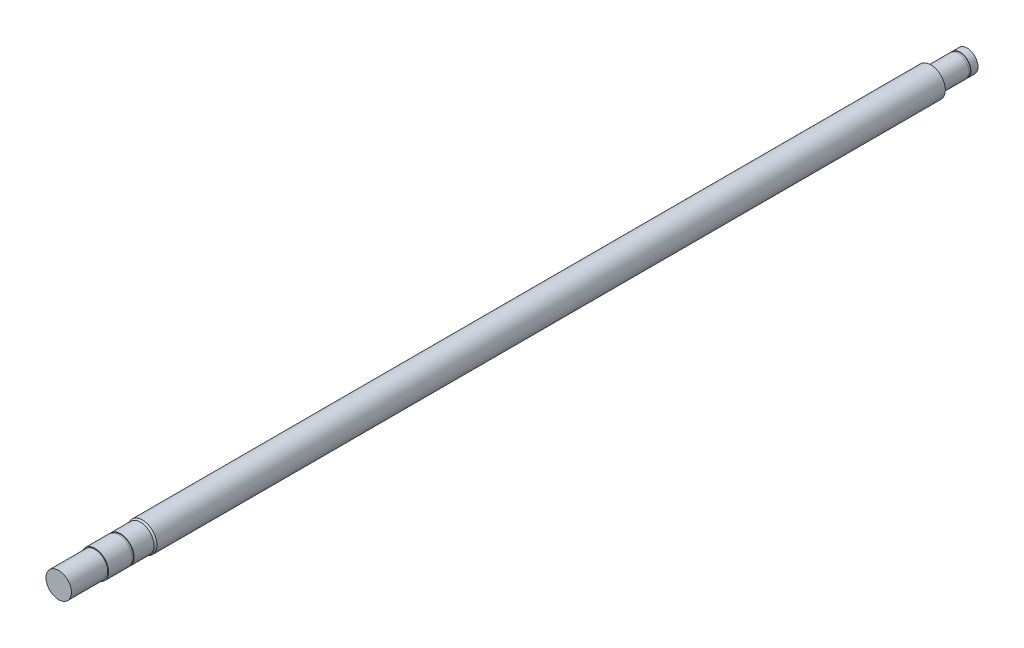
from build123d import *

# Parameters (mm, degrees)
SWEEP_1_PROFILE_R   = 8
SKETCH_11_OUTSIDE_W = 118.102
SKETCH_11_OUTSIDE_H = 118.102
SKETCH_11_OUTSIDE_R = 7
CUT_EXTRUDE_1_DEPTH = 20
SKETCH_16_OUTSIDE_W = 118.102
SKETCH_16_OUTSIDE_H = 118.102
SKETCH_16_OUTSIDE_R = 7.5
CUT_EXTRUDE_3_DEPTH = 25
SKETCH_31_W         = 1.1
SKETCH_31_H         = 0.35
SKETCH_12_OUTSIDE_W = 118.102
SKETCH_12_OUTSIDE_H = 118.102
SKETCH_12_OUTSIDE_R = 6
CUT_EXTRUDE_2_DEPTH = 20
SKETCH_3_W          = 1.1
SKETCH_3_H          = 0.25


# Read off the part's stored shape, not the designer's step: M16 机械螺纹 螺柱1
with BuildPart() as part:
    # 扫描1: sweep along a path in 草图1
    with BuildLine(Plane(origin=(0, 0, 0), x_dir=(0, 0, -1), z_dir=(1, 0, 0))) as sweep_1_path:
        Line((0, 0), (500, 0))
    # 扫描1 profile (on start of the path) → 扫描1 (sweep)
    with BuildSketch(Plane(origin=(0, 0, 0), x_dir=(-1, 0, 0), z_dir=(0, 0, -1))):
        Circle(SWEEP_1_PROFILE_R)
    sweep(path=sweep_1_path.line)

    # 草图11 outside → 切除-拉伸1 (cut)
    with BuildSketch(Plane.XY):
        Rectangle(SKETCH_11_OUTSIDE_W, SKETCH_11_OUTSIDE_H)
        Circle(SKETCH_11_OUTSIDE_R, mode=Mode.SUBTRACT)
    extrude(amount=-CUT_EXTRUDE_1_DEPTH, mode=Mode.SUBTRACT)

    # 草图16 outside → 切除-拉伸3 (cut)
    with BuildSketch(Plane.XY.offset(-20)):
        Rectangle(SKETCH_16_OUTSIDE_W, SKETCH_16_OUTSIDE_H)
        Circle(SKETCH_16_OUTSIDE_R, mode=Mode.SUBTRACT)
    extrude(amount=-CUT_EXTRUDE_3_DEPTH, mode=Mode.SUBTRACT)

    # 草图31 → 切除-旋转11 (revolve, cut)
    with BuildSketch(Plane(origin=(100, 0, -20), x_dir=(0, 0, -1), z_dir=(0, 1, 0))):
        with Locations((13.45, 92.675)):
            Rectangle(SKETCH_31_W, SKETCH_31_H)
    revolve(axis=Axis((0, 0, -20), (0, 0, -1)), mode=Mode.SUBTRACT)

    # 草图12 outside → 切除-拉伸2 (cut)
    with BuildSketch(Plane(origin=(0, 0, -500), x_dir=(-1, 0, 0), z_dir=(0, 0, -1))):
        Rectangle(SKETCH_12_OUTSIDE_W, SKETCH_12_OUTSIDE_H)
        Circle(SKETCH_12_OUTSIDE_R, mode=Mode.SUBTRACT)
    extrude(amount=-CUT_EXTRUDE_2_DEPTH, mode=Mode.SUBTRACT)

    # M16 机械螺纹 螺柱1 outline → M16 机械螺纹 螺柱1 (revolve, cut)
    with BuildSketch(Plane.XZ):
        Polygon((8, -45), (6.9175, -45), (8, -46.0825), align=None)
    revolve(axis=Axis((0, 0, 0), (0, 0, 1)), mode=Mode.SUBTRACT)

    # 草图3 → 切除-旋转1 (revolve, cut)
    with BuildSketch(Plane(origin=(-100, 0, -500), x_dir=(0, 0, 1), z_dir=(0, 1, 0))):
        with Locations((4.45, 94.125)):
            Rectangle(SKETCH_3_W, SKETCH_3_H)
    revolve(axis=Axis((0, 0, -500), (0, 0, 1)), mode=Mode.SUBTRACT)


solid = part.part
